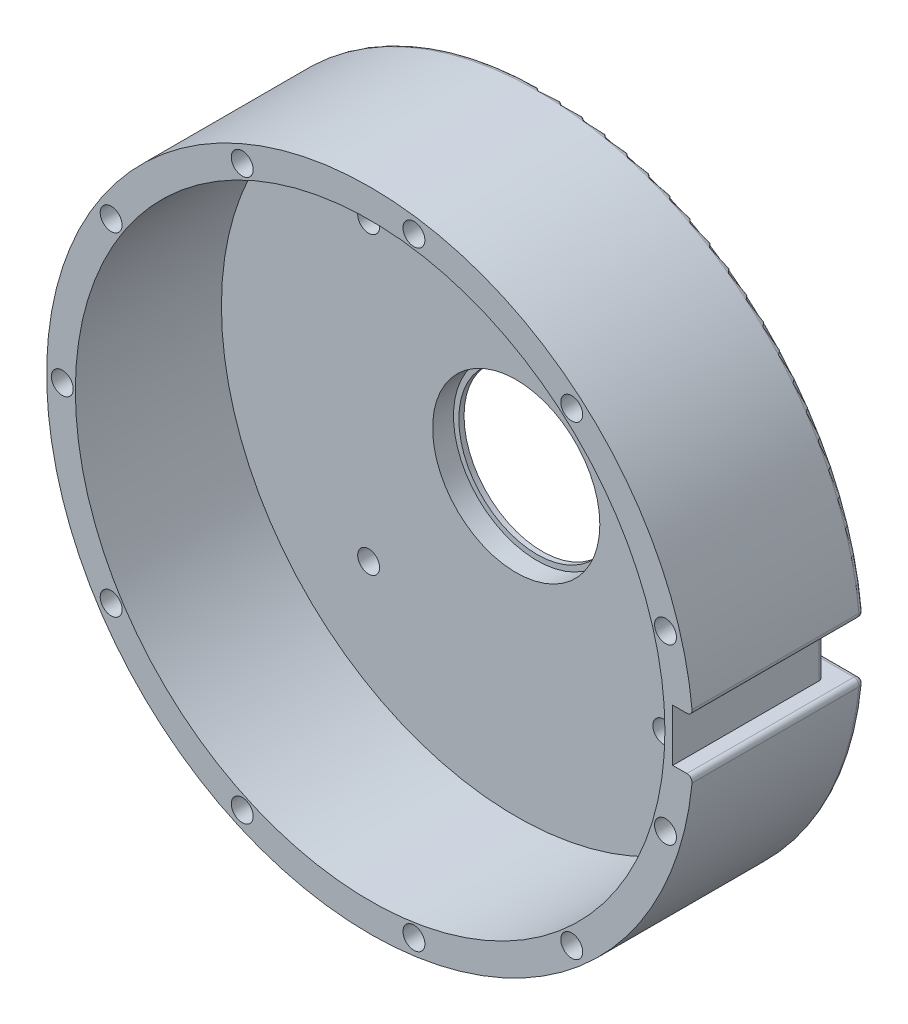
from build123d import *

# Parameters (mm, degrees)
BOSS_EXTRUDE1_OUTLINE_R   = 62
BOSS_EXTRUDE1_OUTLINE_R_2 = 1.575
BOSS_EXTRUDE1_OUTLINE_R_3 = 56.5
BOSS_EXTRUDE1_DEPTH       = 33
BOSS_EXTRUDE2_START       = -5
SKETCH2_R                 = 56.5
SKETCH2_R_2               = 15
BOSS_EXTRUDE2_DEPTH       = 5
SKETCH3_R                 = 16.025
CUT_EXTRUDE1_DEPTH        = 4
SKETCH4_W                 = 8
SKETCH4_H                 = 10
CUT_EXTRUDE2_DEPTH        = 190.339520636
FILLET1_R                 = 1
SKETCH5_R                 = 2.1
CUT_EXTRUDE3_DEPTH        = 5
SKETCH6_W                 = 30
SKETCH6_H                 = 10
CUT_EXTRUDE4_DEPTH        = 4
FILLET2_R                 = 1
SKETCH7_R                 = 2.1
CUT_EXTRUDE5_DEPTH        = 10


# Read off the part's stored shape, not the designer's step: Boss-Extrude1
with BuildPart() as part:
    # Boss-Extrude1 outline → Boss-Extrude1 (new body)
    with BuildSketch(Plane(origin=(0, 0, -63.995840519), x_dir=(-1, 0, 0), z_dir=(0, 0, -1))):
        with Locations((-89.072792821, 47.25870832)):
            Circle(BOSS_EXTRUDE1_OUTLINE_R)
        with Locations((-127.709576124, 2.669483434)):
            Circle(BOSS_EXTRUDE1_OUTLINE_R_2, mode=Mode.SUBTRACT)
        with Locations((-97.469368279, -11.14075675)):
            Circle(BOSS_EXTRUDE1_OUTLINE_R_2, mode=Mode.SUBTRACT)
        with Locations((-145.682878264, 30.636487467)):
            Circle(BOSS_EXTRUDE1_OUTLINE_R_2, mode=Mode.SUBTRACT)
        with Locations((-64.563307054, -6.409579405)):
            Circle(BOSS_EXTRUDE1_OUTLINE_R_2, mode=Mode.SUBTRACT)
        with Locations((-39.438834384, 15.360900091)):
            Circle(BOSS_EXTRUDE1_OUTLINE_R_2, mode=Mode.SUBTRACT)
        with Locations((-145.682878264, 63.880929174)):
            Circle(BOSS_EXTRUDE1_OUTLINE_R_2, mode=Mode.SUBTRACT)
        with Locations((-127.709576124, 91.847933207)):
            Circle(BOSS_EXTRUDE1_OUTLINE_R_2, mode=Mode.SUBTRACT)
        with Locations((-97.469368279, 105.658173391)):
            Circle(BOSS_EXTRUDE1_OUTLINE_R_2, mode=Mode.SUBTRACT)
        with Locations((-89.072792821, 47.25870832)):
            Circle(BOSS_EXTRUDE1_OUTLINE_R_3, mode=Mode.SUBTRACT)
        with Locations((-30.072792821, 47.25870832)):
            Circle(BOSS_EXTRUDE1_OUTLINE_R_2, mode=Mode.SUBTRACT)
        with Locations((-64.563307054, 100.926996046)):
            Circle(BOSS_EXTRUDE1_OUTLINE_R_2, mode=Mode.SUBTRACT)
        with Locations((-39.438834384, 79.15651655)):
            Circle(BOSS_EXTRUDE1_OUTLINE_R_2, mode=Mode.SUBTRACT)
    extrude(amount=BOSS_EXTRUDE1_DEPTH)

    # Sketch2 → Boss-Extrude2 (add)
    with BuildSketch(Plane(origin=(0, 0, -96.995840519), x_dir=(-1, 0, 0), z_dir=(0, 0, -1)).offset(BOSS_EXTRUDE2_START)):
        with Locations((-89.072792821, 47.25870832)):
            Circle(SKETCH2_R)
        with Locations((-89.072792821, 47.25870832)):
            Circle(SKETCH2_R_2, mode=Mode.SUBTRACT)
    extrude(amount=BOSS_EXTRUDE2_DEPTH)

    # Sketch3 → Cut-Extrude1 (cut)
    with BuildSketch(Plane.XY.offset(-91.995840519)):
        with Locations((89.072792821, 47.25870832)):
            Circle(SKETCH3_R)
    extrude(amount=-CUT_EXTRUDE1_DEPTH, mode=Mode.SUBTRACT)

    # Sketch4 → Cut-Extrude2 (cut, through all)
    with BuildSketch(Plane.XY.offset(-63.995840519)):
        with Locations((151.072792821, 47.25870832)):
            Rectangle(SKETCH4_W, SKETCH4_H)
    extrude(amount=-CUT_EXTRUDE2_DEPTH, mode=Mode.SUBTRACT)

    # Fillet1
    fillet1_edges = [part.edges().sort_by_distance(p)[0] for p in [
        (150.870851043, 42.25870832, -80.495840519),
        (150.870851043, 52.25870832, -80.495840519),
    ]]
    fillet(fillet1_edges, radius=FILLET1_R)

    # Sketch5 → Cut-Extrude3 (cut)
    with BuildSketch(Plane(origin=(0, 0, -96.995840519), x_dir=(-1, 0, 0), z_dir=(0, 0, -1))):
        with Locations((-117.357064069, 75.542979568)):
            Circle(SKETCH5_R)
        with Locations((-60.788521574, 75.542979568)):
            Circle(SKETCH5_R)
        with Locations((-60.788521574, 18.974437073)):
            Circle(SKETCH5_R)
        with Locations((-117.357064069, 18.974437073)):
            Circle(SKETCH5_R)
    extrude(amount=-CUT_EXTRUDE3_DEPTH, mode=Mode.SUBTRACT)

    # Sketch6 → Cut-Extrude4 (cut)
    with BuildSketch(Plane(origin=(0, 0, -96.995840519), x_dir=(-1, 0, 0), z_dir=(0, 0, -1))):
        with Locations((-132.072792821, 47.25870832)):
            Rectangle(SKETCH6_W, SKETCH6_H)
    extrude(amount=-CUT_EXTRUDE4_DEPTH, mode=Mode.SUBTRACT)

    # Fillet2
    fillet2_edges = [part.edges().sort_by_distance(p)[0] for p in [
        (147.072792821, 47.25870832, -92.995840519),
        (117.072792821, 47.25870832, -92.995840519),
        (117.072792821, 47.25870832, -96.995840519),
        (133.424893243, 42.25870832, -96.995840519),
        (86.019909262, -14.666083985, -96.995840519),
        (133.424893243, 52.25870832, -96.995840519),
        (150.518060684, 52.587277258, -96.995840519),
        (150.518060684, 41.930139383, -96.995840519),
    ]]
    fillet(fillet2_edges, radius=FILLET2_R)

    # Sketch7 → Cut-Extrude5 (cut)
    with BuildSketch(Plane.XY.offset(-63.995840519)):
        with Locations((30.072792821, 47.25870832)):
            Circle(SKETCH7_R)
        with Locations((39.438834384, 79.15651655)):
            Circle(SKETCH7_R)
        with Locations((64.563307054, 100.926996046)):
            Circle(SKETCH7_R)
        with Locations((97.469368279, 105.658173391)):
            Circle(SKETCH7_R)
        with Locations((127.709576124, 91.847933207)):
            Circle(SKETCH7_R)
        with Locations((145.682878264, 63.880929174)):
            Circle(SKETCH7_R)
        with Locations((145.682878264, 30.636487467)):
            Circle(SKETCH7_R)
        with Locations((127.709576124, 2.669483434)):
            Circle(SKETCH7_R)
        with Locations((97.469368279, -11.14075675)):
            Circle(SKETCH7_R)
        with Locations((64.563307054, -6.409579405)):
            Circle(SKETCH7_R)
        with Locations((39.438834384, 15.360900091)):
            Circle(SKETCH7_R)
    extrude(amount=-CUT_EXTRUDE5_DEPTH, mode=Mode.SUBTRACT)


solid = part.part
